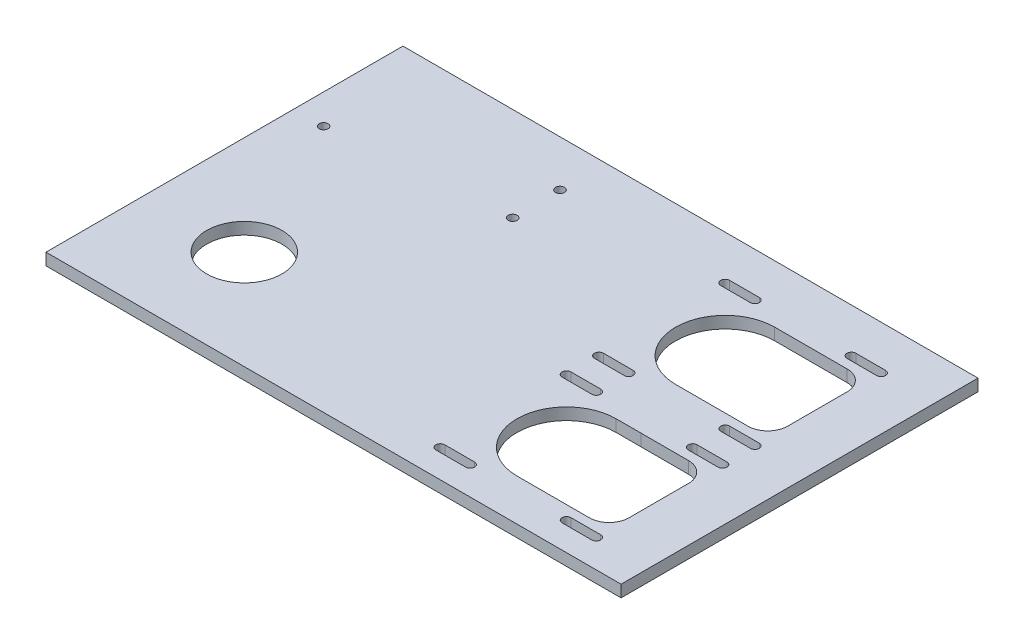
from build123d import *

# Parameters (mm, degrees)
SKETCH1_W            = 290
SKETCH1_H            = 180
BOSS_EXTRUDE1_DEPTH  = 6
SKETCH2_R            = 19
CUT_EXTRUDE1_DEPTH   = 231.295462396
M4_CLEARANCE_HOLE1_D = 4.5
CUT_EXTRUDE3_DEPTH   = 10
CUT_EXTRUDE4_DEPTH   = 10
CUT_EXTRUDE5_DEPTH   = 231.295462396
FILLET1_R            = 10
SKETCH12_W           = 39
SKETCH12_H           = 50
CUT_EXTRUDE6_DEPTH   = 10
FILLET2_R            = 10


with BuildPart() as part:
    # Sketch1 → Boss-Extrude1 (new body)
    with BuildSketch(Plane(origin=(0, 0, 0), x_dir=(1, 0, 0), z_dir=(0, 1, 0))):
        with Locations((45, 40)):
            Rectangle(SKETCH1_W, SKETCH1_H)
    extrude(amount=BOSS_EXTRUDE1_DEPTH)

    # Sketch2 → Cut-Extrude1 (cut, through all)
    with BuildSketch(Plane(origin=(0, 6, 0), x_dir=(1, 0, 0), z_dir=(0, 1, 0))):
        with Locations((-50, 0)):
            Circle(SKETCH2_R)
    extrude(amount=-CUT_EXTRUDE1_DEPTH, mode=Mode.SUBTRACT)

    # M4 Clearance Hole1 (through all)
    with Locations(Plane(origin=(0, 6, 0), x_dir=(1, 0, 0), z_dir=(0, 1, 0))):
        with Locations((-85, 75), (2.391413733, 106.807873329), (2.665133432, 82.669705362)):
            Hole(M4_CLEARANCE_HOLE1_D / 2)

    # Sketch8 → Cut-Extrude3 (cut)
    with BuildSketch(Plane(origin=(0, 6, 0), x_dir=(1, 0, 0), z_dir=(0, 1, 0))):
        with BuildLine():
            Line((84.680194847, 110.069805153), (99.680194847, 110.069805153))
            ThreePointArc((99.680194847, 110.069805153), (101.930194847, 107.819805153), (99.680194847, 105.569805153))
            Line((99.680194847, 105.569805153), (84.680194847, 105.569805153))
            ThreePointArc((84.680194847, 105.569805153), (82.430194847, 107.819805153), (84.680194847, 110.069805153))
        make_face()
        with BuildLine():
            Line((148.319805153, 110.069805153), (163.319805153, 110.069805153))
            ThreePointArc((163.319805153, 110.069805153), (165.569805153, 107.819805153), (163.319805153, 105.569805153))
            Line((163.319805153, 105.569805153), (148.319805153, 105.569805153))
            ThreePointArc((148.319805153, 105.569805153), (146.069805153, 107.819805153), (148.319805153, 110.069805153))
        make_face()
        with BuildLine():
            Line((84.680194847, 46.430194847), (99.680194847, 46.430194847))
            ThreePointArc((99.680194847, 46.430194847), (101.930194847, 44.180194847), (99.680194847, 41.930194847))
            Line((99.680194847, 41.930194847), (84.680194847, 41.930194847))
            ThreePointArc((84.680194847, 41.930194847), (82.430194847, 44.180194847), (84.680194847, 46.430194847))
        make_face()
        with BuildLine():
            Line((148.319805153, 46.430194847), (163.319805153, 46.430194847))
            ThreePointArc((163.319805153, 46.430194847), (165.569805153, 44.180194847), (163.319805153, 41.930194847))
            Line((163.319805153, 41.930194847), (148.319805153, 41.930194847))
            ThreePointArc((148.319805153, 41.930194847), (146.069805153, 44.180194847), (148.319805153, 46.430194847))
        make_face()
        with BuildLine():
            Line((116.5, 101), (131.5, 101))
            ThreePointArc((131.5, 101), (156.5, 76), (131.5, 51))
            Line((131.5, 51), (116.5, 51))
            ThreePointArc((116.5, 51), (91.5, 76), (116.5, 101))
        make_face()
    extrude(amount=-CUT_EXTRUDE3_DEPTH, mode=Mode.SUBTRACT)

    # Sketch9 → Cut-Extrude4 (cut)
    with BuildSketch(Plane(origin=(0, 6, 0), x_dir=(1, 0, 0), z_dir=(0, 1, 0))):
        with BuildLine():
            Line((84.680194847, 30.069805153), (99.680194847, 30.069805153))
            ThreePointArc((99.680194847, 30.069805153), (101.930194847, 27.819805153), (99.680194847, 25.569805153))
            Line((99.680194847, 25.569805153), (84.680194847, 25.569805153))
            ThreePointArc((84.680194847, 25.569805153), (82.430194847, 27.819805153), (84.680194847, 30.069805153))
        make_face()
        with BuildLine():
            Line((148.319805153, 30.069805153), (163.319805153, 30.069805153))
            ThreePointArc((163.319805153, 30.069805153), (165.569805153, 27.819805153), (163.319805153, 25.569805153))
            Line((163.319805153, 25.569805153), (148.319805153, 25.569805153))
            ThreePointArc((148.319805153, 25.569805153), (146.069805153, 27.819805153), (148.319805153, 30.069805153))
        make_face()
        with BuildLine():
            Line((84.680194847, -33.569805153), (99.680194847, -33.569805153))
            ThreePointArc((99.680194847, -33.569805153), (101.930194847, -35.819805153), (99.680194847, -38.069805153))
            Line((99.680194847, -38.069805153), (84.680194847, -38.069805153))
            ThreePointArc((84.680194847, -38.069805153), (82.430194847, -35.819805153), (84.680194847, -33.569805153))
        make_face()
        with BuildLine():
            Line((148.319805153, -33.569805153), (163.319805153, -33.569805153))
            ThreePointArc((163.319805153, -33.569805153), (165.569805153, -35.819805153), (163.319805153, -38.069805153))
            Line((163.319805153, -38.069805153), (148.319805153, -38.069805153))
            ThreePointArc((148.319805153, -38.069805153), (146.069805153, -35.819805153), (148.319805153, -33.569805153))
        make_face()
        with BuildLine():
            Line((116.5, 21), (131.5, 21))
            ThreePointArc((131.5, 21), (156.5, -4), (131.5, -29))
            Line((131.5, -29), (116.5, -29))
            ThreePointArc((116.5, -29), (91.5, -4), (116.5, 21))
        make_face()
    extrude(amount=-CUT_EXTRUDE4_DEPTH, mode=Mode.SUBTRACT)

    # Sketch10 → Cut-Extrude5 (cut, through all)
    with BuildSketch(Plane(origin=(0, 6, 0), x_dir=(1, 0, 0), z_dir=(0, 1, 0))):
        with BuildLine():
            Line((116.5, 21), (129, 21.004881403))
            Line((129, 21.004881403), (163, 21.004881403))
            Line((163, 21.004881403), (163, -29))
            Line((163, -29), (129, -29))
            Line((129, -29), (116.5, -29))
            ThreePointArc((116.5, -29), (91.5, -4), (116.5, 21))
        make_face()
    extrude(amount=-CUT_EXTRUDE5_DEPTH, mode=Mode.SUBTRACT)

    # Fillet1
    fillet1_edges = [part.edges().sort_by_distance(p)[0] for p in [
        (163, 3, 29),
        (163, 3, -21.004881403),
    ]]
    fillet(fillet1_edges, radius=FILLET1_R)

    # Sketch12 → Cut-Extrude6 (cut)
    with BuildSketch(Plane(origin=(0, 6, 0), x_dir=(1, 0, 0), z_dir=(0, 1, 0))):
        with Locations((143.5, 76)):
            Rectangle(SKETCH12_W, SKETCH12_H)
    extrude(amount=-CUT_EXTRUDE6_DEPTH, mode=Mode.SUBTRACT)

    # Fillet2
    fillet2_edges = [part.edges().sort_by_distance(p)[0] for p in [
        (163, 3, -101),
        (163, 3, -51),
    ]]
    fillet(fillet2_edges, radius=FILLET2_R)


solid = part.part
